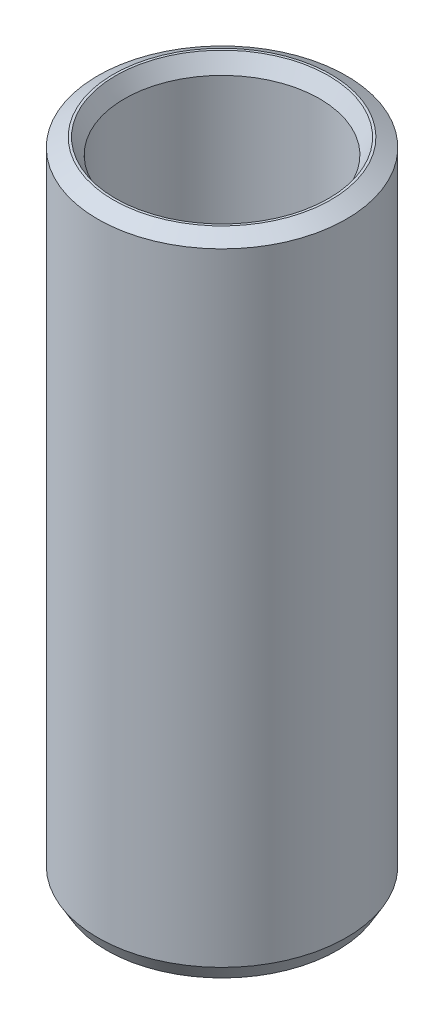
from build123d import *
from OCP.BRepFilletAPI import BRepFilletAPI_MakeChamfer

# Parameters (mm, degrees)
SKETCH1_R           = 35
BOSS_EXTRUDE1_DEPTH = 182.095526754
SKETCH2_R           = 27.462471964
CUT_EXTRUDE1_DEPTH  = 189.702890449
CHAMFER1_SIZE       = 2.518468272
CHAMFER1_SIZE2      = 4.362115004


with BuildPart() as part:
    # Sketch1 → Boss-Extrude1 (new body)
    with BuildSketch(Plane(origin=(0, 0, 0), x_dir=(1, 0, 0), z_dir=(0, 1, 0))):
        Circle(SKETCH1_R)
    extrude(amount=BOSS_EXTRUDE1_DEPTH)

    # Sketch2 → Cut-Extrude1 (cut, through all)
    with BuildSketch(Plane(origin=(0, 0, 0), x_dir=(1, 0, 0), z_dir=(0, 1, 0))):
        Circle(SKETCH2_R)
    extrude(amount=CUT_EXTRUDE1_DEPTH, mode=Mode.SUBTRACT)

    # Chamfer1: one chamfer whose edges measure the first distance from different faces: ONE call of the kernel's chamfer builder (chamfer() names one face for all edges)
    chamfer1_edges_1 = [part.edges().sort_by_distance(p)[0] for p in [
        (-27.462471964, 182.095526754, 0),
    ]]
    chamfer1_side_1 = [part.faces().sort_by_distance(p)[0] for p in [
        (-34.010050506, 182.095526754, 0),
    ]]
    chamfer1_edges_2 = [part.edges().sort_by_distance(p)[0] for p in [
        (-27.462471964, 0, 0),
    ]]
    chamfer1_side_2 = [part.faces().sort_by_distance(p)[0] for p in [
        (-27.462471964, 91.047763377, 0),
    ]]
    chamfer1_edges_3 = [part.edges().sort_by_distance(p)[0] for p in [
        (-35, 0, 0),
    ]]
    chamfer1_side_3 = [part.faces().sort_by_distance(p)[0] for p in [
        (-34.010050506, 0, 0),
    ]]
    chamfer1_edges_4 = [part.edges().sort_by_distance(p)[0] for p in [
        (-35, 182.095526754, 0),
    ]]
    chamfer1_side_4 = [part.faces().sort_by_distance(p)[0] for p in [
        (-35, 91.047763377, 0),
    ]]
    chamfer1 = BRepFilletAPI_MakeChamfer(part.part.solid().wrapped)
    for e in chamfer1_edges_1:
        chamfer1.Add(CHAMFER1_SIZE, CHAMFER1_SIZE2, e.wrapped, chamfer1_side_1[0].wrapped)  # the first distance lies on this face
    for e in chamfer1_edges_2:
        chamfer1.Add(CHAMFER1_SIZE, CHAMFER1_SIZE2, e.wrapped, chamfer1_side_2[0].wrapped)  # the first distance lies on this face
    for e in chamfer1_edges_3:
        chamfer1.Add(CHAMFER1_SIZE, CHAMFER1_SIZE2, e.wrapped, chamfer1_side_3[0].wrapped)  # the first distance lies on this face
    for e in chamfer1_edges_4:
        chamfer1.Add(CHAMFER1_SIZE, CHAMFER1_SIZE2, e.wrapped, chamfer1_side_4[0].wrapped)  # the first distance lies on this face
    add(Compound.cast(chamfer1.Shape()), mode=Mode.REPLACE)


solid = part.part
